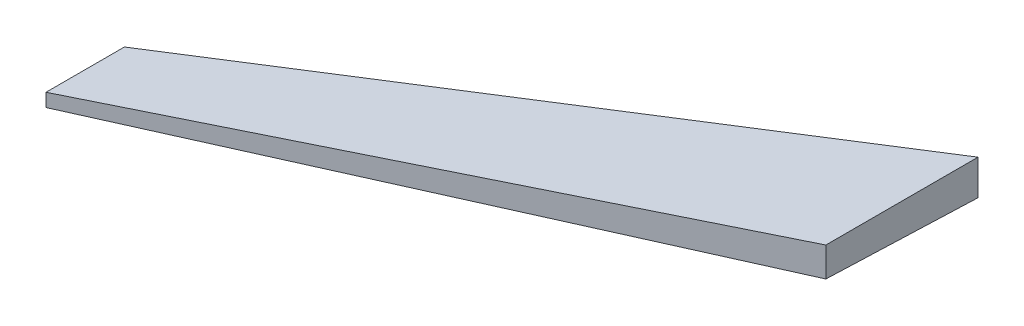
from build123d import *

# Parameters (mm, degrees)
SKETCH4_W          = 14986.678438392
SKETCH4_H          = 7706.357590778
CUT_EXTRUDE1_DEPTH = 5181.6


with BuildPart() as part:
    # Surface-Knit3: read off the stored shape, not the designer's step
    # Surface-Knit3: loft between two sections, ruled curve by curve
    surface_knit3_from = [
        Edge.make_bspline([(-17711.940475464, -80.385008706, 13165.151542886), (-17711.940475464, -85.182687055, 12943.938602187), (-17711.940475464, -89.980365404, 12722.725661487), (-17711.940475464, -99.575722103, 12280.299780089), (-17711.940475464, -104.373400452, 12059.086839389), (-17711.940475464, -109.171078801, 11837.87389869)], [0, 0, 0, 0, 0.5, 0.5, 1, 1, 1, 1], 3),
        Edge.make_line((-17711.940475464, -80.385008706, 13165.151542886), (-17711.940475464, 112.448931944, 13165.151542886)),
        Edge.make_line((-17711.940475464, 112.448931944, 11837.87389869), (-17711.940475464, -109.171078801, 11837.87389869)),
        Edge.make_line((-17711.940475464, 112.448931944, 13165.151542886), (-17711.940475464, 112.448931944, 11837.87389869)),
    ]
    surface_knit3_to = [
        Edge.make_bspline([(0, -298.277774529, 4907.09615841), (0, -321.894328297, 4276.674740223), (0, -345.510882066, 3646.253322036), (0, -392.743989603, 2385.410485661), (0, -416.360543372, 1754.989067474), (0, -439.977097141, 1124.567649286)], [0, 0, 0, 0, 0.5, 0.5, 1, 1, 1, 1], 3),
        Edge.make_line((0, -298.277774529, 4907.09615841), (0, 434.262669848, 4907.09615841)),
        Edge.make_line((0, 434.262669848, 1124.567649286), (0, -439.977097141, 1124.567649286)),
        Edge.make_line((0, 434.262669848, 4907.09615841), (0, 434.262669848, 1124.567649286)),
    ]
    surface_knit3 = Solid(Shell([*[Face.make_surface_from_curves(surface_knit3_from[k], surface_knit3_to[k]) for k in range(4)], Face(Wire(surface_knit3_from)), Face(Wire(surface_knit3_to))]))
    add(surface_knit3)

    # Sketch4 → Cut-Extrude1 (cut, along a direction that is not the sketch's normal)
    with BuildSketch(Plane.ZY.offset(17711.940475464)):
        with Locations((12517.353947819, -161.456903525)):
            Rectangle(SKETCH4_W, SKETCH4_H)
    extrude(amount=-CUT_EXTRUDE1_DEPTH, dir=(-0.8660254037844378, 0, 0.5000000000000014), mode=Mode.SUBTRACT)


solid = part.part
